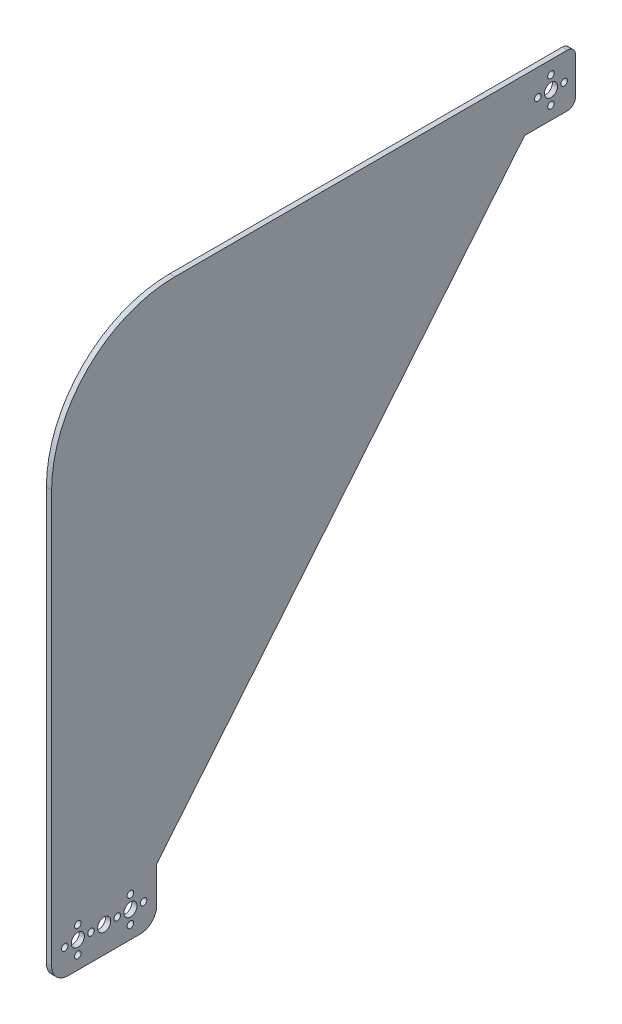
from build123d import *

# Parameters (mm, degrees)
SKETCH1_R           = 4
SKETCH1_R_2         = 2
BOSS_EXTRUDE1_DEPTH = 3.175


with BuildPart() as part:
    # Sketch1 → Boss-Extrude1 (new body)
    with BuildSketch(Plane(origin=(0, 0, 0), x_dir=(0, 0, -1), z_dir=(1, 0, 0))):
        with BuildLine():
            Line((-240, -288), (-240, -310))
            ThreePointArc((-240, -310), (-242.928932188, -317.071067812), (-250, -320))
            Line((-250, -320), (-294, -320))
            ThreePointArc((-294, -320), (-301.071067812, -317.071067812), (-304, -310))
            Line((-304, -310), (-304, -288))
            Line((-304, -288), (-304, -59))
            ThreePointArc((-304, -59), (-282.033008589, -5.966991411), (-229, 16))
            Line((-229, 16), (-16, 16))
            Line((-16, 16), (10, 16))
            ThreePointArc((10, 16), (13.535533906, 14.535533906), (15, 11))
            Line((15, 11), (15, -11))
            ThreePointArc((15, -11), (13.535533906, -14.535533906), (10, -16))
            Line((10, -16), (-16, -16))
            Line((-16, -16), (-240, -288))
        make_face()
        with Locations((-256, -304)):
            Circle(SKETCH1_R, mode=Mode.SUBTRACT)
        Circle(SKETCH1_R, mode=Mode.SUBTRACT)
        with Locations((8, 0)):
            Circle(SKETCH1_R_2, mode=Mode.SUBTRACT)
        with Locations((0, -8)):
            Circle(SKETCH1_R_2, mode=Mode.SUBTRACT)
        with Locations((-8, 0)):
            Circle(SKETCH1_R_2, mode=Mode.SUBTRACT)
        with Locations((0, 8)):
            Circle(SKETCH1_R_2, mode=Mode.SUBTRACT)
        with Locations((-248, -304)):
            Circle(SKETCH1_R_2, mode=Mode.SUBTRACT)
        with Locations((-256, -312)):
            Circle(SKETCH1_R_2, mode=Mode.SUBTRACT)
        with Locations((-256, -296)):
            Circle(SKETCH1_R_2, mode=Mode.SUBTRACT)
        with Locations((-264, -304)):
            Circle(SKETCH1_R_2, mode=Mode.SUBTRACT)
        with Locations((-272, -304)):
            Circle(SKETCH1_R, mode=Mode.SUBTRACT)
        with Locations((-288, -312)):
            Circle(SKETCH1_R_2, mode=Mode.SUBTRACT)
        with Locations((-280, -304)):
            Circle(SKETCH1_R_2, mode=Mode.SUBTRACT)
        with Locations((-288, -296)):
            Circle(SKETCH1_R_2, mode=Mode.SUBTRACT)
        with Locations((-288, -304)):
            Circle(SKETCH1_R, mode=Mode.SUBTRACT)
        with Locations((-296, -304)):
            Circle(SKETCH1_R_2, mode=Mode.SUBTRACT)
    extrude(amount=-BOSS_EXTRUDE1_DEPTH)


solid = part.part
